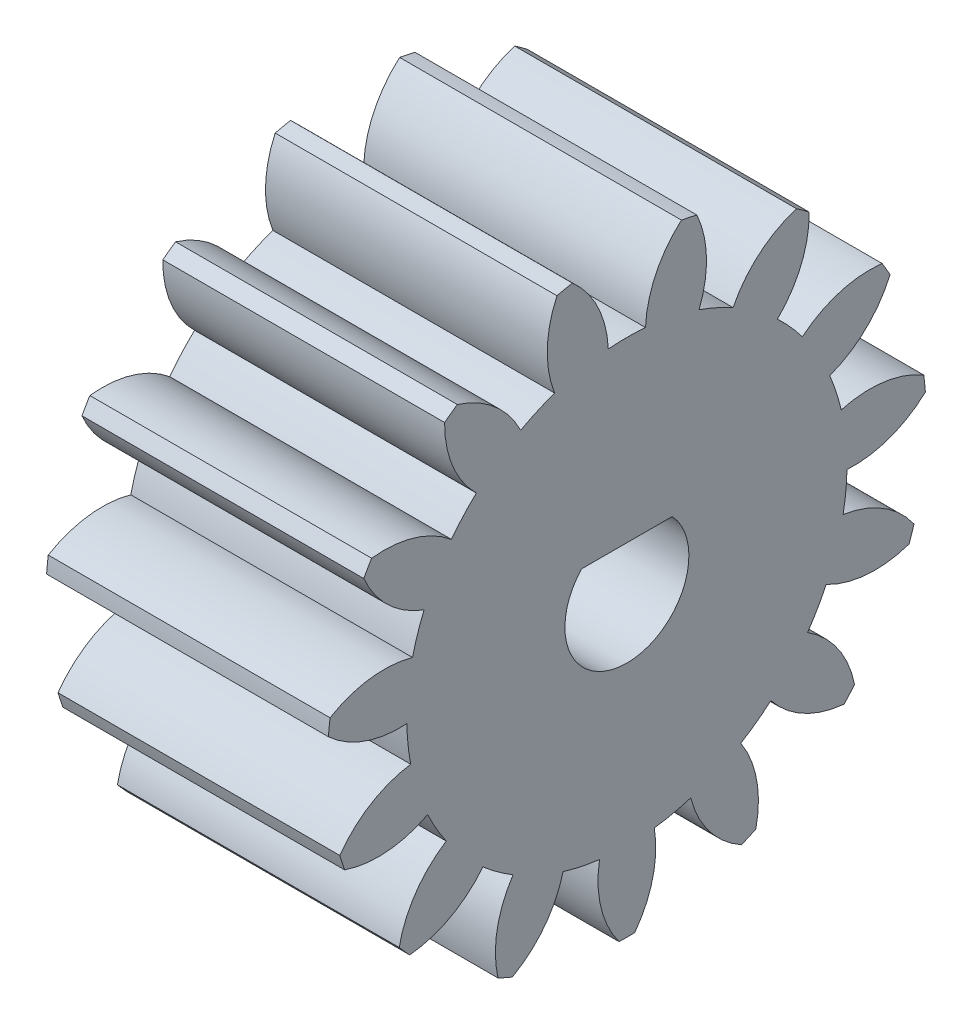
from build123d import *

# Parameters (mm, degrees)
BASPROSKE_W         = 10
BASPROSKE_H         = 10.625
TOOTHCUT_DEPTH      = 19.049411348
TEETHCUTS_COUNT     = 15
TEETHCUTS_ANGLE     = 336
BORSKE_R            = 2
BORE_DEPTH          = 50.0000508
SKETCH1_R           = 2.2
CUT_EXTRUDE2_DEPTH  = 10
BOSS_EXTRUDE1_DEPTH = 10


with BuildPart() as part:
    # BasProSke → Base-Revolve (revolve)
    with BuildSketch(Plane(origin=(0, 0, 0), x_dir=(1, 0, 0), z_dir=(0, 1, 0))):
        with Locations((5, 5.3125)):
            Rectangle(BASPROSKE_W, BASPROSKE_H)
    revolve(axis=Axis((-10, 0, 0), (1, 0, 0)))

    # TooCutSke → ToothCut (cut, through all)
    with BuildSketch(Plane(origin=(0, 0, 0), x_dir=(0, 0, -1), z_dir=(1, 0, 0))):
        with BuildLine():
            ThreePointArc((0.660831632, 7.78349753), (0, 7.8115), (-0.660831632, 7.78349753))
            ThreePointArc((-0.660831632, 7.78349753), (-1.031814994, 9.260718016), (-1.959681305, 10.46855622))
            ThreePointArc((-1.959681305, 10.46855622), (0, 10.6504), (1.959681305, 10.46855622))
            ThreePointArc((1.959681305, 10.46855622), (1.031814994, 9.260718016), (0.660831632, 7.78349753))
        make_face()
    toothcut = extrude(amount=TOOTHCUT_DEPTH, mode=Mode.SUBTRACT)

    # TeethCuts: ToothCut ×15 about axis
    teethcuts_axis = Axis((-10, 0, 0), (1, 0, 0))
    for i in range(1, TEETHCUTS_COUNT):
        add(toothcut.rotate(teethcuts_axis, i * TEETHCUTS_ANGLE / (TEETHCUTS_COUNT - 1)), mode=Mode.SUBTRACT)

    # BorSke → Bore (cut, symmetric)
    with BuildSketch(Plane(origin=(0, 0, 0), x_dir=(0, 0, -1), z_dir=(1, 0, 0))):
        Circle(BORSKE_R)
    extrude(amount=BORE_DEPTH, both=True, mode=Mode.SUBTRACT)

    # Sketch1 → Cut-Extrude2 (cut)
    with BuildSketch(Plane(origin=(10, 0, 0), x_dir=(0, 0, -1), z_dir=(1, 0, 0))):
        Circle(SKETCH1_R)
    extrude(amount=-CUT_EXTRUDE2_DEPTH, mode=Mode.SUBTRACT)

    # Sketch4 → Boss-Extrude1 (add)
    with BuildSketch(Plane(origin=(10, 0, 0), x_dir=(0, 0, -1), z_dir=(1, 0, 0))):
        with BuildLine():
            ThreePointArc((1.609347694, 1.5), (0, 2.2), (-1.609347694, 1.5))
            Line((-1.609347694, 1.5), (1.609347694, 1.5))
        make_face()
    extrude(amount=-BOSS_EXTRUDE1_DEPTH)


solid = part.part
